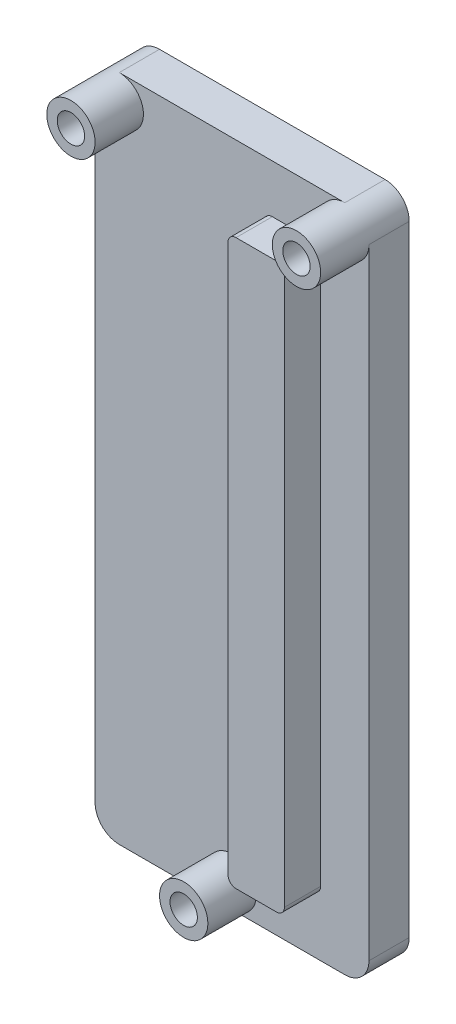
from build123d import *

# Parameters (mm, degrees)
BOSS_EXTRU_2_DEPTH = 5
ESQUISSE4_R        = 3
BOSS_EXTRU_3_DEPTH = 6
D_GAGEMENT_M31_D   = 3.4
BOSS_EXTRU_4_DEPTH = 4.5


with BuildPart() as part:
    # Esquisse1 → Boss.-Extru.2 (new body)
    with BuildSketch(Plane.XY):
        with BuildLine():
            Line((3, 0), (31, 0))
            ThreePointArc((31, 0), (33.121320344, 0.878679656), (34, 3))
            Line((34, 3), (34, 80))
            ThreePointArc((34, 80), (33.121320344, 82.121320344), (31, 83))
            Line((31, 83), (3, 83))
            ThreePointArc((3, 83), (0.878679656, 82.121320344), (0, 80))
            Line((0, 80), (0, 3))
            ThreePointArc((0, 3), (0.878679656, 0.878679656), (3, 0))
        make_face()
    extrude(amount=BOSS_EXTRU_2_DEPTH)

    # Esquisse4 → Boss.-Extru.3 (add)
    with BuildSketch(Plane.XY.offset(5)):
        with Locations((3, 80)):
            Circle(ESQUISSE4_R)
        with Locations((31, 80)):
            Circle(ESQUISSE4_R)
        with Locations((17, 3)):
            Circle(ESQUISSE4_R)
    extrude(amount=BOSS_EXTRU_3_DEPTH)

    # Dégagement M31 (through all)
    with Locations(Plane.XY.offset(11)):
        with Locations((3, 80), (31, 80), (17, 3)):
            Hole(D_GAGEMENT_M31_D / 2)

    # Esquisse2 → Boss.-Extru.4 (add)
    with BuildSketch(Plane.XY.offset(5)):
        with BuildLine():
            Line((22, 77), (27, 77))
            ThreePointArc((27, 77), (27.707106781, 76.707106781), (28, 76))
            Line((28, 76), (28, 8))
            ThreePointArc((28, 8), (27.707106781, 7.292893219), (27, 7))
            Line((27, 7), (22, 7))
            ThreePointArc((22, 7), (21.292893219, 7.292893219), (21, 8))
            Line((21, 8), (21, 76))
            ThreePointArc((21, 76), (21.292893219, 76.707106781), (22, 77))
        make_face()
    extrude(amount=BOSS_EXTRU_4_DEPTH)


solid = part.part
